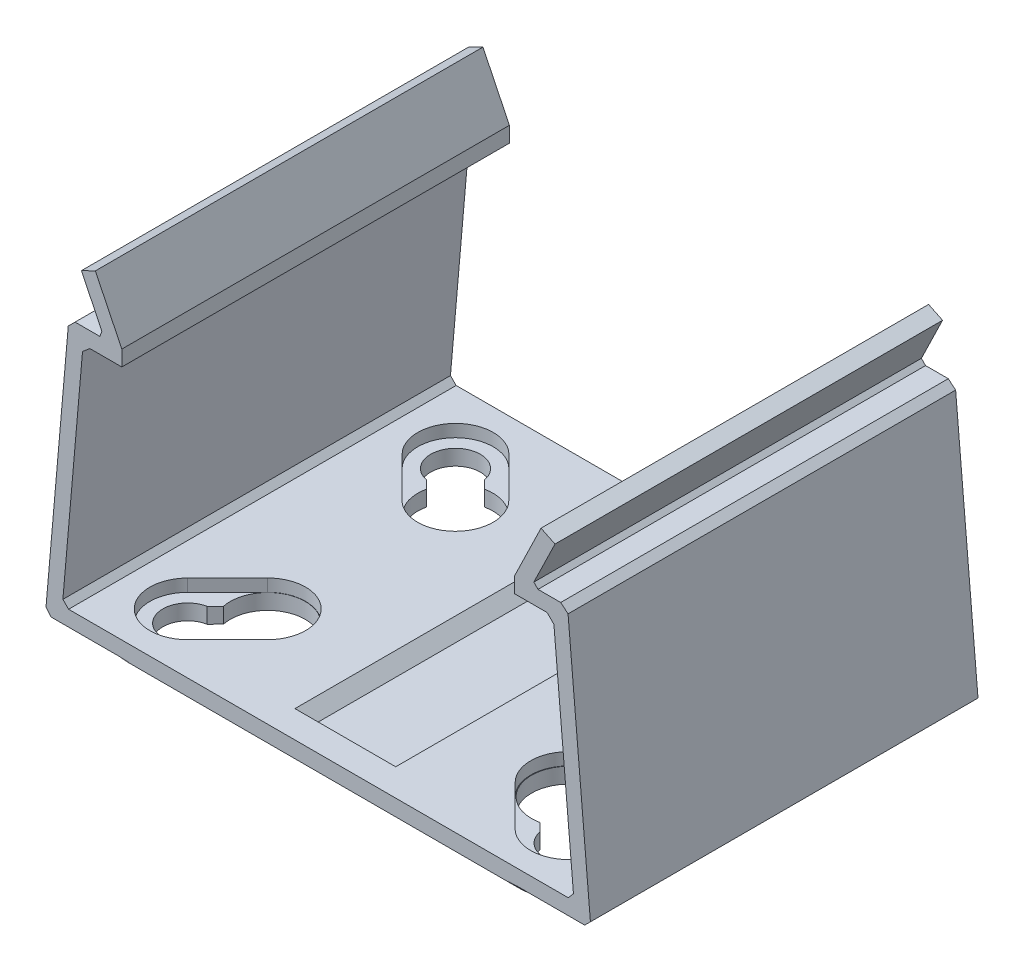
from build123d import *
from OCP.BRepFilletAPI import BRepFilletAPI_MakeChamfer

# Parameters (mm, degrees)
BOSS_EXTRUDE1_DEPTH = 50
SKETCH5_W           = 63
SKETCH5_H           = 50
BOSS_EXTRUDE2_DEPTH = 1.6
SKETCH9_W           = 10
SKETCH9_H           = 40
CUT_EXTRUDE4_DEPTH  = 1.5
CHAMFER4_SIZE       = 1.5
CHAMFER6_SIZE       = 0.8
CHAMFER6_SIZE2      = 0.738449877
CHAMFER7_SIZE       = 0.8
CHAMFER7_SIZE2      = 0.880050294
CHAMFER7_SIZE2_2    = 0.59857957
FILLET1_R           = 7
CHAMFER10_SIZE      = 1.5
CUT_EXTRUDE5_REACH  = 74.773
CUT_EXTRUDE6_DEPTH  = 1.6


with BuildPart() as part:
    # Sketch1 → Boss-Extrude1 (new body)
    with BuildSketch(Plane.XY):
        Polygon((-32.16425811, 32.5), (-27.555232111, 32.5), (-30.546782223, 38.65618727), (-28.747926936, 39.530326652), (-25.331595762, 32.5), (-25.331595762, 30.5), (-30.331595762, 30.5), (-33, 0), (0, 0), (33, 0), (30.331595762, 30.5), (25.331595762, 30.5), (25.331595762, 32.5), (28.747926936, 39.530326652), (30.546782223, 38.65618727), (27.555232111, 32.5), (32.16425811, 32.5), (35.182617002, -2), (0, -2), (-35.182617002, -2), align=None)
    extrude(amount=BOSS_EXTRUDE1_DEPTH)

    # Sketch5 → Boss-Extrude2 (add)
    with BuildSketch(Plane.XZ.offset(2)):
        with Locations((0, 25)):
            Rectangle(SKETCH5_W, SKETCH5_H)
    extrude(amount=BOSS_EXTRUDE2_DEPTH)

    # Sketch9 → Cut-Extrude4 (cut)
    with BuildSketch(Plane(origin=(0, 0, 0), x_dir=(1, 0, 0), z_dir=(0, 1, 0))):
        with Locations((0, -25)):
            Rectangle(SKETCH9_W, SKETCH9_H)
    extrude(amount=-CUT_EXTRUDE4_DEPTH, mode=Mode.SUBTRACT)

    # Chamfer4
    chamfer4_edges = [part.edges().sort_by_distance(p)[0] for p in [
        (0, 0, 45),
        (-5, 0, 25),
        (0, 0, 5),
        (5, 0, 25),
    ]]
    chamfer(chamfer4_edges, length=CHAMFER4_SIZE - 0.0001)  # a hair under: the kernel refuses the full size

    # Chamfer6: one chamfer whose edges measure the first distance from different faces: ONE call of the kernel's chamfer builder (chamfer() names one face for all edges)
    chamfer6_edges_1 = [part.edges().sort_by_distance(p)[0] for p in [
        (-33, 0, 25),
    ]]
    chamfer6_side_1 = [part.faces().sort_by_distance(p)[0] for p in [
        (0, 0, 47.327909662),
    ]]
    chamfer6_edges_2 = [part.edges().sort_by_distance(p)[0] for p in [
        (33, 0, 25),
    ]]
    chamfer6_side_2 = [part.faces().sort_by_distance(p)[0] for p in [
        (31.665797881, 15.25, 25),
    ]]
    chamfer6_edges_3 = [part.edges().sort_by_distance(p)[0] for p in [
        (35.182617002, -2, 25),
    ]]
    chamfer6_side_3 = [part.faces().sort_by_distance(p)[0] for p in [
        (33.341308501, -2, 25),
    ]]
    chamfer6_edges_4 = [part.edges().sort_by_distance(p)[0] for p in [
        (-35.182617002, -2, 25),
    ]]
    chamfer6_side_4 = [part.faces().sort_by_distance(p)[0] for p in [
        (-33.673437556, 15.25, 25),
    ]]
    chamfer6 = BRepFilletAPI_MakeChamfer(part.part.solid().wrapped)
    for e in chamfer6_edges_1:
        chamfer6.Add(CHAMFER6_SIZE, CHAMFER6_SIZE2, e.wrapped, chamfer6_side_1[0].wrapped)  # the first distance lies on this face
    for e in chamfer6_edges_2:
        chamfer6.Add(CHAMFER6_SIZE, CHAMFER6_SIZE2, e.wrapped, chamfer6_side_2[0].wrapped)  # the first distance lies on this face
    for e in chamfer6_edges_3:
        chamfer6.Add(CHAMFER6_SIZE, CHAMFER6_SIZE2, e.wrapped, chamfer6_side_3[0].wrapped)  # the first distance lies on this face
    for e in chamfer6_edges_4:
        chamfer6.Add(CHAMFER6_SIZE, CHAMFER6_SIZE2, e.wrapped, chamfer6_side_4[0].wrapped)  # the first distance lies on this face
    add(Compound.cast(chamfer6.Shape()), mode=Mode.REPLACE)

    # Chamfer7: one chamfer whose edges measure the first distance from different faces: ONE call of the kernel's chamfer builder (chamfer() names one face for all edges)
    chamfer7_edges_1 = [part.edges().sort_by_distance(p)[0] for p in [
        (-30.331595762, 30.5, 25),
    ]]
    chamfer7_side_1 = [part.faces().sort_by_distance(p)[0] for p in [
        (-31.633617807, 15.617819926, 25),
    ]]
    chamfer7_edges_2 = [part.edges().sort_by_distance(p)[0] for p in [
        (30.331595762, 30.5, 25),
    ]]
    chamfer7_side_2 = [part.faces().sort_by_distance(p)[0] for p in [
        (27.831595762, 30.5, 25),
    ]]
    chamfer7_edges_3 = [part.edges().sort_by_distance(p)[0] for p in [
        (27.555232111, 32.5, 25),
    ]]
    chamfer7_side_3 = [part.faces().sort_by_distance(p)[0] for p in [
        (29.859745111, 32.5, 25),
    ]]
    chamfer7_edges_4 = [part.edges().sort_by_distance(p)[0] for p in [
        (32.16425811, 32.5, 25),
    ]]
    chamfer7_side_4 = [part.faces().sort_by_distance(p)[0] for p in [
        (33.641257483, 15.617819926, 25),
    ]]
    chamfer7_edges_5 = [part.edges().sort_by_distance(p)[0] for p in [
        (-32.16425811, 32.5, 25),
    ]]
    chamfer7_side_5 = [part.faces().sort_by_distance(p)[0] for p in [
        (-29.859745111, 32.5, 25),
    ]]
    chamfer7_edges_6 = [part.edges().sort_by_distance(p)[0] for p in [
        (-27.555232111, 32.5, 25),
    ]]
    chamfer7_side_6 = [part.faces().sort_by_distance(p)[0] for p in [
        (-29.051007167, 35.578093635, 25),
    ]]
    chamfer7 = BRepFilletAPI_MakeChamfer(part.part.solid().wrapped)
    for e in chamfer7_edges_1:
        chamfer7.Add(CHAMFER7_SIZE, CHAMFER7_SIZE2, e.wrapped, chamfer7_side_1[0].wrapped)  # the first distance lies on this face
    for e in chamfer7_edges_2:
        chamfer7.Add(CHAMFER7_SIZE, CHAMFER7_SIZE2, e.wrapped, chamfer7_side_2[0].wrapped)  # the first distance lies on this face
    for e in chamfer7_edges_3:
        chamfer7.Add(CHAMFER7_SIZE, CHAMFER7_SIZE2_2, e.wrapped, chamfer7_side_3[0].wrapped)  # the first distance lies on this face
    for e in chamfer7_edges_4:
        chamfer7.Add(CHAMFER7_SIZE, CHAMFER7_SIZE2, e.wrapped, chamfer7_side_4[0].wrapped)  # the first distance lies on this face
    for e in chamfer7_edges_5:
        chamfer7.Add(CHAMFER7_SIZE, CHAMFER7_SIZE2, e.wrapped, chamfer7_side_5[0].wrapped)  # the first distance lies on this face
    for e in chamfer7_edges_6:
        chamfer7.Add(CHAMFER7_SIZE, CHAMFER7_SIZE2_2, e.wrapped, chamfer7_side_6[0].wrapped)  # the first distance lies on this face
    add(Compound.cast(chamfer7.Shape()), mode=Mode.REPLACE)

    # Fillet1
    fillet1_edges = [part.edges().sort_by_distance(p)[0] for p in [
        (-31.5, -2.8, 0),
        (31.5, -2.8, 0),
        (31.5, -2.8, 50),
        (-31.5, -2.8, 50),
    ]]
    fillet(fillet1_edges, radius=FILLET1_R)

    # Chamfer10
    chamfer10_edges = [part.edges().sort_by_distance(p)[0] for p in [
        (-31.5, -3.6, 25),
        (0, -3.6, 50),
        (0, -3.6, 0),
        (31.5, -3.6, 25),
        (29.449747468, -3.6, 47.949747468),
        (29.449747468, -3.6, 2.050252532),
        (-29.449747468, -3.6, 2.050252532),
        (-29.449747468, -3.6, 47.949747468),
    ]]
    chamfer(chamfer10_edges, length=CHAMFER10_SIZE)

    # Sketch15 → Cut-Extrude5 (cut, up to next)
    with BuildSketch(Plane(origin=(0, 0, 0), x_dir=(1, 0, 0), z_dir=(0, 1, 0)), mode=Mode.PRIVATE) as cut_extrude5_sk1:
        with BuildLine():
            Line((21.475016583, -42.866268583), (20.428249938, -41.819501939))
            ThreePointArc((20.428249938, -41.819501939), (16.022847213, -33.655561292), (24.186787861, -38.060964016))
            Line((24.186787861, -38.060964016), (25.233554505, -39.107730661))
            ThreePointArc((25.233554505, -39.107730661), (26.877324102, -44.51003818), (21.475016583, -42.866268583))
        make_face()
    cut_extrude5_tool1 = extrude(cut_extrude5_sk1.sketch, amount=-CUT_EXTRUDE5_REACH, mode=Mode.PRIVATE) & part.part
    # Sketch15 → Cut-Extrude5 (cut, up to next)
    with BuildSketch(Plane(origin=(0, 0, 0), x_dir=(1, 0, 0), z_dir=(0, 1, 0)), mode=Mode.PRIVATE) as cut_extrude5_sk2:
        with BuildLine():
            Line((-25.185393692, -39.138763585), (-24.139916413, -38.090709162))
            ThreePointArc((-24.139916413, -38.090709162), (-15.98140501, -33.675259948), (-20.37675457, -41.844617469))
            Line((-20.37675457, -41.844617469), (-21.422231849, -42.892671893))
            ThreePointArc((-21.422231849, -42.892671893), (-26.822511792, -44.543090495), (-25.185393692, -39.138763585))
        make_face()
    cut_extrude5_tool2 = extrude(cut_extrude5_sk2.sketch, amount=-CUT_EXTRUDE5_REACH, mode=Mode.PRIVATE) & part.part
    # Sketch15 → Cut-Extrude5 (cut, up to next)
    with BuildSketch(Plane(origin=(0, 0, 0), x_dir=(1, 0, 0), z_dir=(0, 1, 0)), mode=Mode.PRIVATE) as cut_extrude5_sk3:
        with BuildLine():
            Line((25.233554505, -10.892269339), (24.186787861, -11.939035984))
            ThreePointArc((24.186787861, -11.939035984), (16.022847213, -16.344438708), (20.428249938, -8.180498061))
            Line((20.428249938, -8.180498061), (21.475016583, -7.133731417))
            ThreePointArc((21.475016583, -7.133731417), (26.877324102, -5.48996182), (25.233554505, -10.892269339))
        make_face()
    cut_extrude5_tool3 = extrude(cut_extrude5_sk3.sketch, amount=-CUT_EXTRUDE5_REACH, mode=Mode.PRIVATE) & part.part
    # Sketch15 → Cut-Extrude5 (cut, up to next)
    with BuildSketch(Plane(origin=(0, 0, 0), x_dir=(1, 0, 0), z_dir=(0, 1, 0)), mode=Mode.PRIVATE) as cut_extrude5_sk4:
        with BuildLine():
            Line((-21.422231849, -7.107328107), (-20.37675457, -8.155382531))
            ThreePointArc((-20.37675457, -8.155382531), (-15.98140501, -16.324740052), (-24.139916413, -11.909290838))
            Line((-24.139916413, -11.909290838), (-25.185393692, -10.861236415))
            ThreePointArc((-25.185393692, -10.861236415), (-26.822511792, -5.456909505), (-21.422231849, -7.107328107))
        make_face()
    cut_extrude5_tool4 = extrude(cut_extrude5_sk4.sketch, amount=-CUT_EXTRUDE5_REACH, mode=Mode.PRIVATE) & part.part
    add(cut_extrude5_tool1.solids().sort_by_distance((21.014912, 0, 38.647626))[0], mode=Mode.SUBTRACT)
    add(cut_extrude5_tool2.solids().sort_by_distance((-20.96732, 0, 38.673466))[0], mode=Mode.SUBTRACT)
    add(cut_extrude5_tool3.solids().sort_by_distance((21.014912, 0, 11.352374))[0], mode=Mode.SUBTRACT)
    add(cut_extrude5_tool4.solids().sort_by_distance((-20.96732, 0, 11.326534))[0], mode=Mode.SUBTRACT)

    # Sketch16 → Cut-Extrude6 (cut)
    with BuildSketch(Plane(origin=(0, 0, 0), x_dir=(1, 0, 0), z_dir=(0, 1, 0))):
        with BuildLine():
            Line((-15.951616609, -40.543181032), (-21.113676241, -45.71796535))
            ThreePointArc((-21.113676241, -45.71796535), (-28.002957525, -45.726446075), (-28.011438251, -38.837164791))
            Line((-28.011438251, -38.837164791), (-22.849378618, -33.662380473))
            ThreePointArc((-22.849378618, -33.662380473), (-15.960097334, -33.653899748), (-15.951616609, -40.543181032))
        make_face()
        with BuildLine():
            Line((-15.951616609, -9.456818968), (-21.113676241, -4.28203465))
            ThreePointArc((-21.113676241, -4.28203465), (-28.002957525, -4.273553925), (-28.011438251, -11.162835209))
            Line((-28.011438251, -11.162835209), (-22.849378618, -16.337619527))
            ThreePointArc((-22.849378618, -16.337619527), (-15.960097334, -16.346100252), (-15.951616609, -9.456818968))
        make_face()
        with BuildLine():
            Line((15.951616609, -40.543181032), (21.113676241, -45.71796535))
            ThreePointArc((21.113676241, -45.71796535), (28.002957525, -45.726446075), (28.011438251, -38.837164791))
            Line((28.011438251, -38.837164791), (22.849378618, -33.662380473))
            ThreePointArc((22.849378618, -33.662380473), (15.960097334, -33.653899748), (15.951616609, -40.543181032))
        make_face()
        with BuildLine():
            Line((15.951616609, -9.456818968), (21.113676241, -4.28203465))
            ThreePointArc((21.113676241, -4.28203465), (28.002957525, -4.273553925), (28.011438251, -11.162835209))
            Line((28.011438251, -11.162835209), (22.849378618, -16.337619527))
            ThreePointArc((22.849378618, -16.337619527), (15.960097334, -16.346100252), (15.951616609, -9.456818968))
        make_face()
    extrude(amount=-CUT_EXTRUDE6_DEPTH, mode=Mode.SUBTRACT)


solid = part.part
